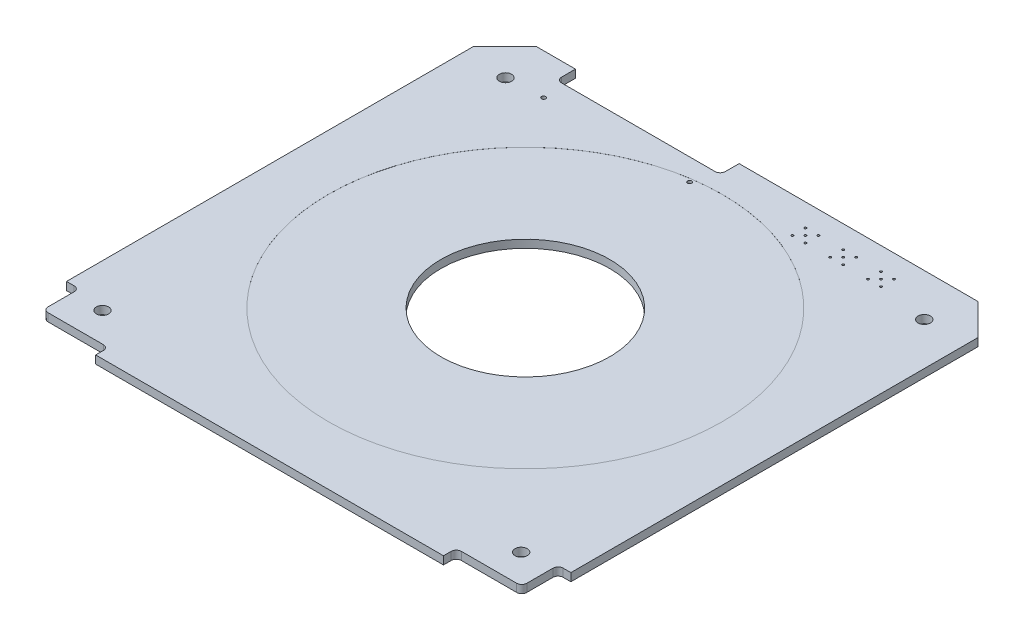
from build123d import *

# Parameters (mm, degrees)
SKETCH1_R                = 0.4
SKETCH1_R_2              = 0.2125
BOSS_EXTRUDE1_DEPTH      = 1.56
M2_CLEARANCE_HOLE2_D     = 2.4
M2_CLEARANCE_HOLE2_DEPTH = 38.1
M2_CLEARANCE_HOLE2_TIP   = 0.721032743
SKETCH2_R                = 38.5
CUT_EXTRUDE1_DEPTH       = 0.01
SKETCH10_R               = 16.5
CUT_EXTRUDE2_DEPTH       = 10


with BuildPart() as part:
    # Sketch1 → Boss-Extrude1 (new body)
    with BuildSketch(Plane(origin=(0, 0, 0), x_dir=(1, 0, 0), z_dir=(0, 1, 0))):
        with BuildLine():
            Line((-49.356685196, 41.604788024), (-43.256685196, 47.704788024))
            Line((-43.256685196, 47.704788024), (-35.556685196, 47.704788024))
            Line((-35.556685196, 47.704788024), (-35.556685196, 45.004788024))
            ThreePointArc((-35.556685196, 45.004788024), (-35.263791977, 44.297681243), (-34.556685196, 44.004788024))
            Line((-34.556685196, 44.004788024), (-4.556685196, 44.004788024))
            ThreePointArc((-4.556685196, 44.004788024), (-3.849578415, 44.297681243), (-3.556685196, 45.004788024))
            Line((-3.556685196, 45.004788024), (-3.556685196, 47.704788024))
            Line((-3.556685196, 47.704788024), (43.143314804, 47.704788024))
            Line((43.143314804, 47.704788024), (49.243314804, 41.604788024))
            Line((49.243314804, 41.604788024), (49.243314804, -37.995211976))
            Line((49.243314804, -37.995211976), (47.743314804, -37.995211976))
            ThreePointArc((47.743314804, -37.995211976), (47.036208023, -38.288105194), (46.743314804, -38.995211976))
            Line((46.743314804, -38.995211976), (46.743314804, -44.095211976))
            ThreePointArc((46.743314804, -44.095211976), (46.450421585, -44.802318757), (45.743314804, -45.095211976))
            Line((45.743314804, -45.095211976), (34.943314804, -45.095211976))
            ThreePointArc((34.943314804, -45.095211976), (34.236208023, -45.388105194), (33.943314804, -46.095211976))
            Line((33.943314804, -46.095211976), (33.943314804, -47.595211976))
            Line((33.943314804, -47.595211976), (-34.056685196, -47.595211976))
            Line((-34.056685196, -47.595211976), (-34.056685196, -46.095211976))
            ThreePointArc((-34.056685196, -46.095211976), (-34.349578415, -45.388105194), (-35.056685196, -45.095211976))
            Line((-35.056685196, -45.095211976), (-45.856685196, -45.095211976))
            ThreePointArc((-45.856685196, -45.095211976), (-46.563791977, -44.802318757), (-46.856685196, -44.095211976))
            Line((-46.856685196, -44.095211976), (-46.856685196, -38.995211976))
            ThreePointArc((-46.856685196, -38.995211976), (-47.149578415, -38.288105194), (-47.856685196, -37.995211976))
            Line((-47.856685196, -37.995211976), (-49.356685196, -37.995211976))
            Line((-49.356685196, -37.995211976), (-49.356685196, 41.604788024))
        make_face()
        with Locations((-33.826685196, 39.744788024)):
            Circle(SKETCH1_R, mode=Mode.SUBTRACT)
        with Locations((-5.276685196, 39.744788024)):
            Circle(SKETCH1_R, mode=Mode.SUBTRACT)
        with Locations((29.883314804, 42.004788024)):
            Circle(SKETCH1_R_2, mode=Mode.SUBTRACT)
        with Locations((28.613314804, 43.274788024)):
            Circle(SKETCH1_R_2, mode=Mode.SUBTRACT)
        with Locations((31.153314804, 43.274788024)):
            Circle(SKETCH1_R_2, mode=Mode.SUBTRACT)
        with Locations((31.153314804, 40.734788024)):
            Circle(SKETCH1_R_2, mode=Mode.SUBTRACT)
        with Locations((28.613314804, 40.734788024)):
            Circle(SKETCH1_R_2, mode=Mode.SUBTRACT)
        with Locations((22.483314804, 42.004788024)):
            Circle(SKETCH1_R_2, mode=Mode.SUBTRACT)
        with Locations((21.213314804, 43.274788024)):
            Circle(SKETCH1_R_2, mode=Mode.SUBTRACT)
        with Locations((23.753314804, 43.274788024)):
            Circle(SKETCH1_R_2, mode=Mode.SUBTRACT)
        with Locations((23.753314804, 40.734788024)):
            Circle(SKETCH1_R_2, mode=Mode.SUBTRACT)
        with Locations((21.213314804, 40.734788024)):
            Circle(SKETCH1_R_2, mode=Mode.SUBTRACT)
        with Locations((15.083314804, 42.004788024)):
            Circle(SKETCH1_R_2, mode=Mode.SUBTRACT)
        with Locations((13.813314804, 43.274788024)):
            Circle(SKETCH1_R_2, mode=Mode.SUBTRACT)
        with Locations((16.353314804, 43.274788024)):
            Circle(SKETCH1_R_2, mode=Mode.SUBTRACT)
        with Locations((16.353314804, 40.734788024)):
            Circle(SKETCH1_R_2, mode=Mode.SUBTRACT)
        with Locations((13.813314804, 40.734788024)):
            Circle(SKETCH1_R_2, mode=Mode.SUBTRACT)
    extrude(amount=BOSS_EXTRUDE1_DEPTH)

    # M2 Clearance Hole2
    with Locations(Plane(origin=(0, 1.56, 0), x_dir=(1, 0, 0), z_dir=(0, 1, 0))):
        with Locations((-40.929491149, 39.39737116), (40.929491149, 39.39737116), (40.929491149, -39.39737116), (-40.929491149, -39.39737116)):
            Hole(M2_CLEARANCE_HOLE2_D / 2, depth=M2_CLEARANCE_HOLE2_DEPTH)
            with Locations((0, 0, -(M2_CLEARANCE_HOLE2_DEPTH + M2_CLEARANCE_HOLE2_TIP / 2))):  # 118° drill point
                Cone(0, M2_CLEARANCE_HOLE2_D / 2, M2_CLEARANCE_HOLE2_TIP, mode=Mode.SUBTRACT)

    # Sketch2 → Cut-Extrude1 (cut)
    with BuildSketch(Plane(origin=(0, 1.56, 0), x_dir=(1, 0, 0), z_dir=(0, 1, 0))):
        with Locations((0, 2.34737116)):
            Circle(SKETCH2_R)
    extrude(amount=-CUT_EXTRUDE1_DEPTH, mode=Mode.SUBTRACT)

    # Sketch10 → Cut-Extrude2 (cut)
    with BuildSketch(Plane(origin=(0, 1.55, 0), x_dir=(1, 0, 0), z_dir=(0, 1, 0))):
        with Locations((0, 2.34737116)):
            Circle(SKETCH10_R)
    extrude(amount=-CUT_EXTRUDE2_DEPTH, mode=Mode.SUBTRACT)


solid = part.part
